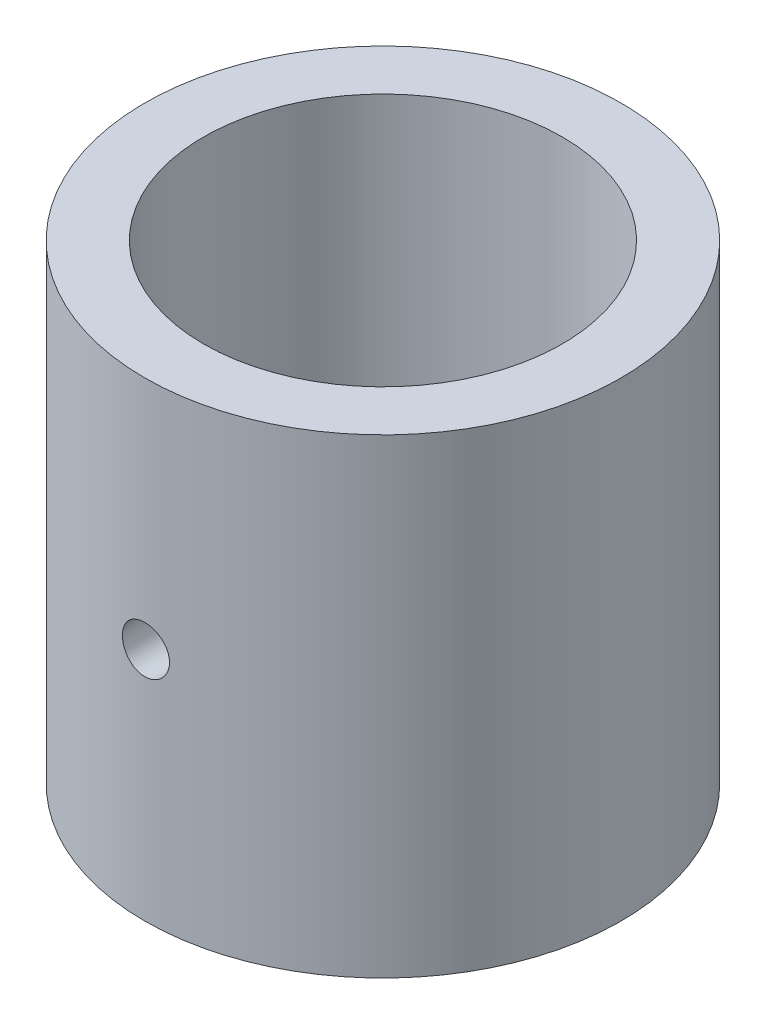
from build123d import *

# Parameters (mm, degrees)
SKETCH1_R           = 20.25
SKETCH1_R_2         = 15.25
BOSS_EXTRUDE1_DEPTH = 40
SKETCH2_R           = 2
CUT_EXTRUDE1_DEPTH  = 42


with BuildPart() as part:
    # Sketch1 → Boss-Extrude1 (new body)
    with BuildSketch(Plane(origin=(0, 0, 0), x_dir=(1, 0, 0), z_dir=(0, 1, 0))):
        Circle(SKETCH1_R)
        Circle(SKETCH1_R_2, mode=Mode.SUBTRACT)
    extrude(amount=BOSS_EXTRUDE1_DEPTH)

    # Sketch2 → Cut-Extrude1 (cut)
    with BuildSketch(Plane.XY.offset(20.25)):
        with Locations((0, 20)):
            Circle(SKETCH2_R)
    extrude(amount=-CUT_EXTRUDE1_DEPTH, mode=Mode.SUBTRACT)


solid = part.part
